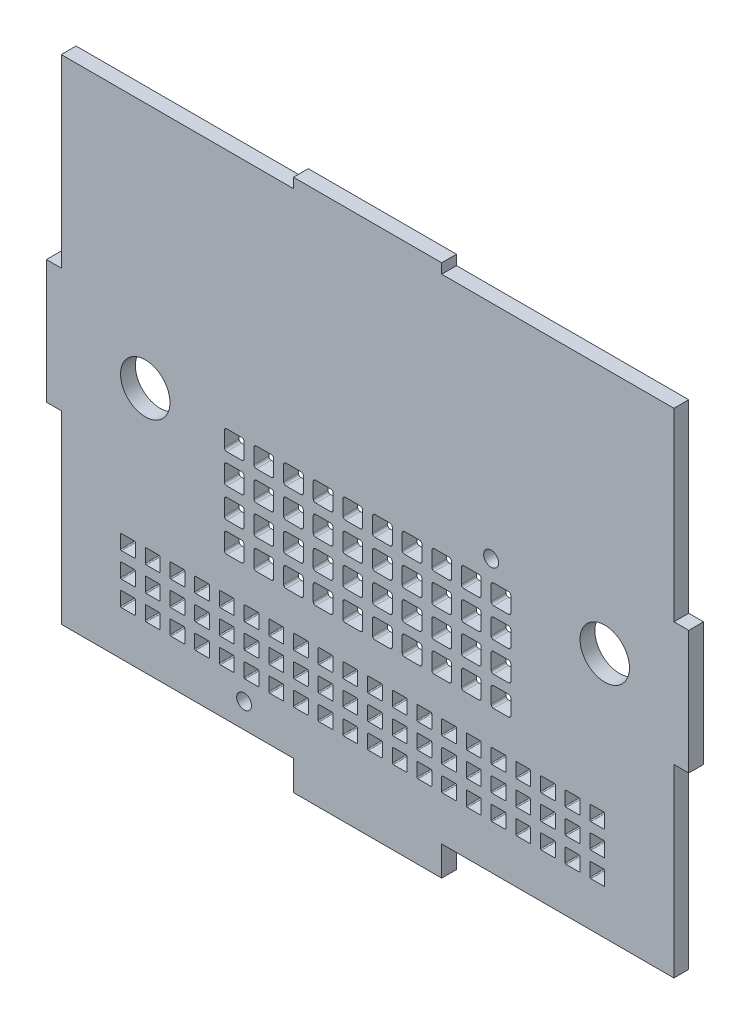
from build123d import *

# Parameters (mm, degrees)
BOSS_EXTRUDE1_DEPTH  = 3
SKETCH2_R            = 1.5
CUT_EXTRUDE1_DEPTH   = 163.829541546
SKETCH3_R            = 5
CUT_EXTRUDE2_DEPTH   = 163.829541546
CUT_EXTRUDE3_DEPTH   = 163.829541546
LPATTERN1_COUNT      = 4
LPATTERN1_PITCH      = 6
LPATTERN1_COUNT_DIR2 = 10
LPATTERN1_PITCH_DIR2 = 6
CUT_EXTRUDE4_DEPTH   = 163.829541546
LPATTERN2_COUNT      = 3
LPATTERN2_PITCH      = 5
LPATTERN2_COUNT_DIR2 = 20
LPATTERN2_PITCH_DIR2 = 5


with BuildPart() as part:
    # Sketch1 → Boss-Extrude1 (new body)
    with BuildSketch(Plane.XY):
        Polygon((0, 0), (47, 0), (47, -6), (77, -6), (77, 0), (124, 0), (124, 37.43), (127, 37.43), (127, 62.43), (124, 62.43), (124, 99.86), (77, 99.86), (77, 101.86), (47, 101.86), (47, 99.86), (0, 99.86), (0, 62.43), (-3, 62.43), (-3, 37.43), (0, 37.43), align=None)
    extrude(amount=BOSS_EXTRUDE1_DEPTH)

    # Sketch2 → Cut-Extrude1 (cut, through all)
    with BuildSketch(Plane.XY.offset(3)):
        with Locations((87, 55)):
            Circle(SKETCH2_R)
        with Locations((37, 5)):
            Circle(SKETCH2_R)
    extrude(amount=-CUT_EXTRUDE1_DEPTH, mode=Mode.SUBTRACT)

    # Sketch3 → Cut-Extrude2 (cut, through all)
    with BuildSketch(Plane.XY.offset(3)):
        with Locations((17, 49.86)):
            Circle(SKETCH3_R)
        with Locations((110, 49.86)):
            Circle(SKETCH3_R)
    extrude(amount=-CUT_EXTRUDE2_DEPTH, mode=Mode.SUBTRACT)

    # Sketch4 → Cut-Extrude3 (cut, through all)
    with BuildSketch(Plane.XY.offset(3)):
        with BuildLine():
            Line((33.5, 51), (36.5, 51))
            ThreePointArc((36.5, 51), (36.853553391, 50.853553391), (37, 50.5))
            Line((37, 50.5), (37, 47.5))
            ThreePointArc((37, 47.5), (36.853553391, 47.146446609), (36.5, 47))
            Line((36.5, 47), (33.5, 47))
            ThreePointArc((33.5, 47), (33.146446609, 47.146446609), (33, 47.5))
            Line((33, 47.5), (33, 50.5))
            ThreePointArc((33, 50.5), (33.146446609, 50.853553391), (33.5, 51))
        make_face()
    cut_extrude3 = extrude(amount=-CUT_EXTRUDE3_DEPTH, mode=Mode.SUBTRACT)

    # LPattern1: Cut-Extrude3 4 × 10
    with Locations(*[(j * LPATTERN1_PITCH_DIR2, -i * LPATTERN1_PITCH, 0) for i in range(LPATTERN1_COUNT) for j in range(LPATTERN1_COUNT_DIR2) if (i, j) != (0, 0)]):
        add(cut_extrude3, mode=Mode.SUBTRACT)

    # Sketch5 → Cut-Extrude4 (cut, through all)
    with BuildSketch(Plane.XY.offset(3)):
        with BuildLine():
            Line((12.2, 12), (14.8, 12))
            ThreePointArc((14.8, 12), (14.941421356, 11.941421356), (15, 11.8))
            Line((15, 11.8), (15, 9.2))
            ThreePointArc((15, 9.2), (14.941421356, 9.058578644), (14.8, 9))
            Line((14.8, 9), (12.2, 9))
            ThreePointArc((12.2, 9), (12.058578644, 9.058578644), (12, 9.2))
            Line((12, 9.2), (12, 11.8))
            ThreePointArc((12, 11.8), (12.058578644, 11.941421356), (12.2, 12))
        make_face()
    cut_extrude4 = extrude(amount=-CUT_EXTRUDE4_DEPTH, mode=Mode.SUBTRACT)

    # LPattern2: Cut-Extrude4 3 × 20
    with Locations(*[(j * LPATTERN2_PITCH_DIR2, i * LPATTERN2_PITCH, 0) for i in range(LPATTERN2_COUNT) for j in range(LPATTERN2_COUNT_DIR2) if (i, j) != (0, 0)]):
        add(cut_extrude4, mode=Mode.SUBTRACT)


solid = part.part
